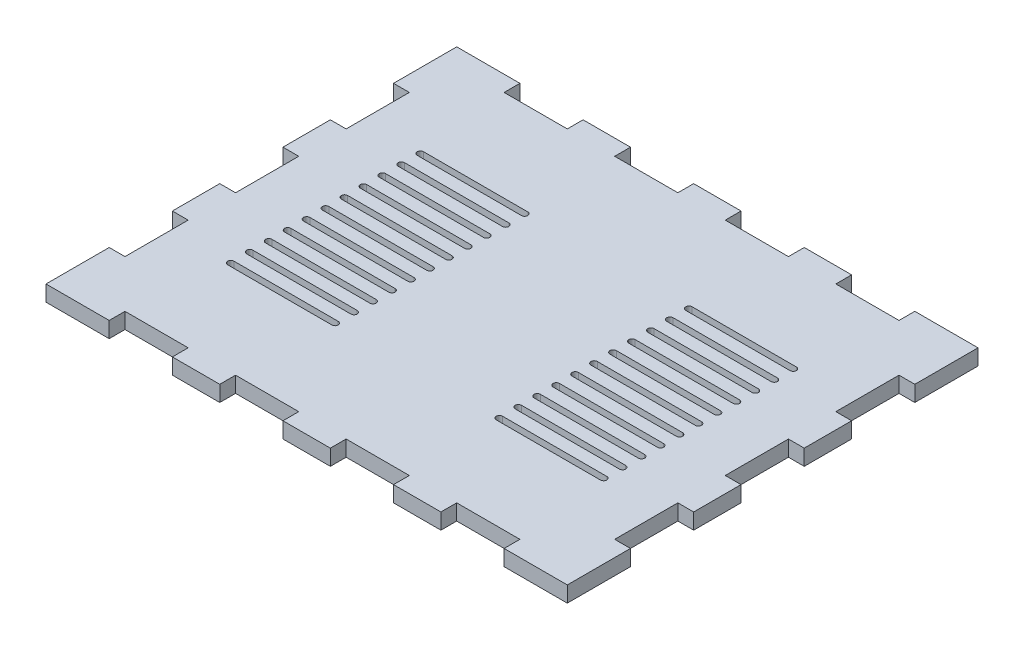
from build123d import *

# Parameters (mm, degrees)
BOSS_EXTRUDE1_DEPTH        = 5
SKETCH2_W                  = 35
SKETCH2_H                  = 2
CUT_EXTRUDE1_DEPTH         = 5
FILLET1_R                  = 1
LPATTERN1_COUNT            = 6
LPATTERN1_PITCH            = 6
FILLET1_OF_LPATTERN1_R     = 1
LPATTERN1_COL_COUNT        = 6
LPATTERN1_COL_PITCH        = 6
FILLET1_OF_LPATTERN1_COL_R = 1
MIRROR1_DEPTH              = 5


# Read off the part's stored shape, not the designer's step: Mirror1
with BuildPart() as part:
    # Sketch1 → Boss-Extrude1 (new body)
    with BuildSketch(Plane(origin=(0, 0, 0), x_dir=(1, 0, 0), z_dir=(0, 1, 0))):
        Polygon((-82.5, 60), (-82.5, 65), (-77.5, 65), (-62.5, 65), (-62.5, 60), (-42.5, 60), (-42.5, 65), (-27.5, 65), (-27.5, 60), (-7.5, 60), (-7.5, 65), (7.5, 65), (7.5, 60), (27.5, 60), (27.5, 65), (42.5, 65), (42.5, 60), (62.5, 60), (62.5, 65), (77.5, 65), (82.5, 65), (82.5, 60), (82.5, 45), (77.5, 45), (77.5, 25), (82.5, 25), (82.5, 10), (77.5, 10), (77.5, -10), (82.5, -10), (82.5, -25), (77.5, -25), (77.5, -45), (82.5, -45), (82.5, -60), (82.5, -65), (77.5, -65), (62.5, -65), (62.5, -60), (42.5, -60), (42.5, -65), (27.5, -65), (27.5, -60), (7.5, -60), (7.5, -65), (-7.5, -65), (-7.5, -60), (-27.5, -60), (-27.5, -65), (-42.5, -65), (-42.5, -60), (-62.5, -60), (-62.5, -65), (-77.5, -65), (-82.5, -65), (-82.5, -60), (-82.5, -45), (-77.5, -45), (-77.5, -25), (-82.5, -25), (-82.5, -10), (-77.5, -10), (-77.5, 10), (-82.5, 10), (-82.5, 25), (-77.5, 25), (-77.5, 45), (-82.5, 45), align=None)
    extrude(amount=BOSS_EXTRUDE1_DEPTH)

    # Sketch2 → Cut-Extrude1 (cut)
    with BuildSketch(Plane(origin=(0, 5, 0), x_dir=(1, 0, 0), z_dir=(0, 1, 0))):
        with Locations((-42.5, 0)):
            Rectangle(SKETCH2_W, SKETCH2_H)
    cut_extrude1 = extrude(amount=-CUT_EXTRUDE1_DEPTH, mode=Mode.SUBTRACT)

    # Fillet1
    fillet1_edges = [part.edges().sort_by_distance(p)[0] for p in [
        (-60, 2.5, 1),
        (-25, 2.5, 1),
        (-60, 2.5, -1),
        (-25, 2.5, -1),
    ]]
    fillet(fillet1_edges, radius=FILLET1_R - 0.0001)  # a hair under: the kernel refuses the full size

    # LPattern1: Cut-Extrude1 ×6
    with Locations(*[(0, 0, i * LPATTERN1_PITCH) for i in range(1, LPATTERN1_COUNT)]):
        add(cut_extrude1, mode=Mode.SUBTRACT)

    # Fillet1 of LPattern1
    fillet1_of_lpattern1_edges = [part.edges().sort_by_distance(p)[0] for p in [
        (-60, 2.5, 7),
        (-25, 2.5, 7),
        (-60, 2.5, 5),
        (-25, 2.5, 5),
        (-60, 2.5, 13),
        (-25, 2.5, 13),
        (-60, 2.5, 11),
        (-25, 2.5, 11),
        (-60, 2.5, 19),
        (-25, 2.5, 19),
        (-60, 2.5, 17),
        (-25, 2.5, 17),
        (-60, 2.5, 25),
        (-25, 2.5, 25),
        (-60, 2.5, 23),
        (-25, 2.5, 23),
        (-60, 2.5, 31),
        (-25, 2.5, 31),
        (-60, 2.5, 29),
        (-25, 2.5, 29),
    ]]
    fillet(fillet1_of_lpattern1_edges, radius=FILLET1_OF_LPATTERN1_R - 0.0001)  # a hair under: the kernel refuses the full size

    # LPattern1 col: Cut-Extrude1 ×6
    with Locations(*[(0, 0, -i * LPATTERN1_COL_PITCH) for i in range(1, LPATTERN1_COL_COUNT)]):
        add(cut_extrude1, mode=Mode.SUBTRACT)

    # Fillet1 of LPattern1 col
    fillet1_of_lpattern1_col_edges = [part.edges().sort_by_distance(p)[0] for p in [
        (-60, 2.5, -5),
        (-25, 2.5, -5),
        (-60, 2.5, -7),
        (-25, 2.5, -7),
        (-60, 2.5, -11),
        (-25, 2.5, -11),
        (-60, 2.5, -13),
        (-25, 2.5, -13),
        (-60, 2.5, -17),
        (-25, 2.5, -17),
        (-60, 2.5, -19),
        (-25, 2.5, -19),
        (-60, 2.5, -23),
        (-25, 2.5, -23),
        (-60, 2.5, -25),
        (-25, 2.5, -25),
        (-60, 2.5, -29),
        (-25, 2.5, -29),
        (-60, 2.5, -31),
        (-25, 2.5, -31),
    ]]
    fillet(fillet1_of_lpattern1_col_edges, radius=FILLET1_OF_LPATTERN1_COL_R - 0.0001)  # a hair under: the kernel refuses the full size

    # Mirror1 outline → Mirror1 (cut)
    with BuildSketch(Plane(origin=(0, 0, 0), x_dir=(1, 0, 0), z_dir=(0, 1, 0))):
        with BuildLine():
            Line((26, -1), (59, -1))
            ThreePointArc((59, -1), (59.707106781, -0.707106781), (60, 0))
            ThreePointArc((60, 0), (59.707106781, 0.707106781), (59, 1))
            Line((59, 1), (26, 1))
            ThreePointArc((26, 1), (25.292893219, 0.707106781), (25, 0))
            ThreePointArc((25, 0), (25.292893219, -0.707106781), (26, -1))
        make_face()
        with BuildLine():
            Line((26, 5), (59, 5))
            ThreePointArc((59, 5), (59.707106781, 5.292893219), (60, 6))
            ThreePointArc((60, 6), (59.707106781, 6.707106781), (59, 7))
            Line((59, 7), (26, 7))
            ThreePointArc((26, 7), (25.292893219, 6.707106781), (25, 6))
            ThreePointArc((25, 6), (25.292893219, 5.292893219), (26, 5))
        make_face()
        with BuildLine():
            Line((26, -31), (59, -31))
            ThreePointArc((59, -31), (59.707106781, -30.707106781), (60, -30))
            ThreePointArc((60, -30), (59.707106781, -29.292893219), (59, -29))
            Line((59, -29), (26, -29))
            ThreePointArc((26, -29), (25.292893219, -29.292893219), (25, -30))
            ThreePointArc((25, -30), (25.292893219, -30.707106781), (26, -31))
        make_face()
        with BuildLine():
            Line((26, -25), (59, -25))
            ThreePointArc((59, -25), (59.707106781, -24.707106781), (60, -24))
            ThreePointArc((60, -24), (59.707106781, -23.292893219), (59, -23))
            Line((59, -23), (26, -23))
            ThreePointArc((26, -23), (25.292893219, -23.292893219), (25, -24))
            ThreePointArc((25, -24), (25.292893219, -24.707106781), (26, -25))
        make_face()
        with BuildLine():
            Line((26, -19), (59, -19))
            ThreePointArc((59, -19), (59.707106781, -18.707106781), (60, -18))
            ThreePointArc((60, -18), (59.707106781, -17.292893219), (59, -17))
            Line((59, -17), (26, -17))
            ThreePointArc((26, -17), (25.292893219, -17.292893219), (25, -18))
            ThreePointArc((25, -18), (25.292893219, -18.707106781), (26, -19))
        make_face()
        with BuildLine():
            Line((26, -13), (59, -13))
            ThreePointArc((59, -13), (59.707106781, -12.707106781), (60, -12))
            ThreePointArc((60, -12), (59.707106781, -11.292893219), (59, -11))
            Line((59, -11), (26, -11))
            ThreePointArc((26, -11), (25.292893219, -11.292893219), (25, -12))
            ThreePointArc((25, -12), (25.292893219, -12.707106781), (26, -13))
        make_face()
        with BuildLine():
            Line((26, -7), (59, -7))
            ThreePointArc((59, -7), (59.707106781, -6.707106781), (60, -6))
            ThreePointArc((60, -6), (59.707106781, -5.292893219), (59, -5))
            Line((59, -5), (26, -5))
            ThreePointArc((26, -5), (25.292893219, -5.292893219), (25, -6))
            ThreePointArc((25, -6), (25.292893219, -6.707106781), (26, -7))
        make_face()
        with BuildLine():
            Line((26, 29), (59, 29))
            ThreePointArc((59, 29), (59.707106781, 29.292893219), (60, 30))
            ThreePointArc((60, 30), (59.707106781, 30.707106781), (59, 31))
            Line((59, 31), (26, 31))
            ThreePointArc((26, 31), (25.292893219, 30.707106781), (25, 30))
            ThreePointArc((25, 30), (25.292893219, 29.292893219), (26, 29))
        make_face()
        with BuildLine():
            Line((26, 23), (59, 23))
            ThreePointArc((59, 23), (59.707106781, 23.292893219), (60, 24))
            ThreePointArc((60, 24), (59.707106781, 24.707106781), (59, 25))
            Line((59, 25), (26, 25))
            ThreePointArc((26, 25), (25.292893219, 24.707106781), (25, 24))
            ThreePointArc((25, 24), (25.292893219, 23.292893219), (26, 23))
        make_face()
        with BuildLine():
            Line((26, 17), (59, 17))
            ThreePointArc((59, 17), (59.707106781, 17.292893219), (60, 18))
            ThreePointArc((60, 18), (59.707106781, 18.707106781), (59, 19))
            Line((59, 19), (26, 19))
            ThreePointArc((26, 19), (25.292893219, 18.707106781), (25, 18))
            ThreePointArc((25, 18), (25.292893219, 17.292893219), (26, 17))
        make_face()
        with BuildLine():
            Line((26, 11), (59, 11))
            ThreePointArc((59, 11), (59.707106781, 11.292893219), (60, 12))
            ThreePointArc((60, 12), (59.707106781, 12.707106781), (59, 13))
            Line((59, 13), (26, 13))
            ThreePointArc((26, 13), (25.292893219, 12.707106781), (25, 12))
            ThreePointArc((25, 12), (25.292893219, 11.292893219), (26, 11))
        make_face()
    extrude(amount=MIRROR1_DEPTH, mode=Mode.SUBTRACT)


solid = part.part
